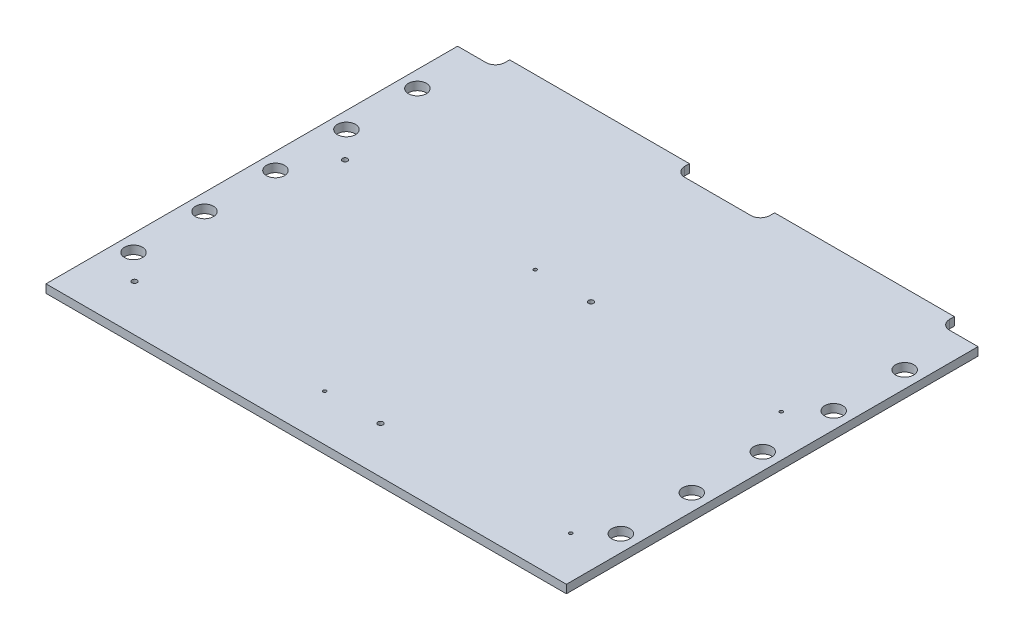
from build123d import *

# Parameters (mm, degrees)
FR4_DEPTH                           = 1.7526
SKETCH7_R                           = 1.905
CUT_EXTRUDE1_DEPTH                  = 143.1375095
SKETCH8_R                           = 0.55
SKETCH8_R_2                         = 0.35
CONTROLLED_DEPTH_HOLES_TOP_DEPTH    = 1.1176
SKETCH9_R                           = 0.55
SKETCH9_R_2                         = 0.35
CONTROLLED_DEPTH_HOLES_BOTTOM_DEPTH = 1.1176


with BuildPart() as part:
    # Sketch1 → FR4 (new body)
    with BuildSketch(Plane(origin=(0, 0, 0), x_dir=(1, 0, 0), z_dir=(0, 1, 0))):
        with BuildLine():
            Line((0, 0), (110, 0))
            Line((110, 0), (110, 87))
            Line((110, 87), (104, 87))
            ThreePointArc((104, 87), (102.585786438, 87.585786438), (102, 89))
            Line((102, 89), (102, 90))
            Line((102, 90), (64, 90))
            Line((64, 90), (64, 89))
            ThreePointArc((64, 89), (63.414213562, 87.585786438), (62, 87))
            Line((62, 87), (48, 87))
            ThreePointArc((48, 87), (46.585786438, 87.585786438), (46, 89))
            Line((46, 89), (46, 90))
            Line((46, 90), (8, 90))
            Line((8, 90), (8, 89))
            ThreePointArc((8, 89), (7.414213562, 87.585786438), (6, 87))
            Line((6, 87), (0, 87))
            Line((0, 87), (0, 0))
        make_face()
    extrude(amount=FR4_DEPTH)

    # Sketch7 → Cut-Extrude1 (cut, through all)
    with BuildSketch(Plane(origin=(0, 1.7526, 0), x_dir=(1, 0, 0), z_dir=(0, 1, 0))):
        with Locations((3.5, 15)):
            Circle(SKETCH7_R)
        with Locations((106.5, 15)):
            Circle(SKETCH7_R)
        with Locations((106.5, 30)):
            Circle(SKETCH7_R)
        with Locations((106.5, 45)):
            Circle(SKETCH7_R)
        with Locations((106.5, 60)):
            Circle(SKETCH7_R)
        with Locations((106.5, 75)):
            Circle(SKETCH7_R)
        with Locations((3.5, 30)):
            Circle(SKETCH7_R)
        with Locations((3.5, 45)):
            Circle(SKETCH7_R)
        with Locations((3.5, 60)):
            Circle(SKETCH7_R)
        with Locations((3.5, 75)):
            Circle(SKETCH7_R)
    extrude(amount=-CUT_EXTRUDE1_DEPTH, mode=Mode.SUBTRACT)

    # Sketch8 → controlled-depth-holes.top (cut)
    with BuildSketch(Plane(origin=(0, 1.7526, 0), x_dir=(1, 0, 0), z_dir=(0, 1, 0))):
        with Locations((8.9, 9.8)):
            Circle(SKETCH8_R)
        with Locations((60.9, 9.8)):
            Circle(SKETCH8_R)
        with Locations((60.9, 54.3)):
            Circle(SKETCH8_R)
        with Locations((8.9, 54.3)):
            Circle(SKETCH8_R)
        with Locations((49.1, 9.8)):
            Circle(SKETCH8_R_2)
        with Locations((101.1, 9.8)):
            Circle(SKETCH8_R_2)
        with Locations((101.1, 54.3)):
            Circle(SKETCH8_R_2)
        with Locations((49.1, 54.3)):
            Circle(SKETCH8_R_2)
    extrude(amount=-CONTROLLED_DEPTH_HOLES_TOP_DEPTH, mode=Mode.SUBTRACT)

    # Sketch9 → controlled-depth-holes.bottom (cut)
    with BuildSketch(Plane.XZ):
        with Locations((8.9, -9.5)):
            Circle(SKETCH9_R)
        with Locations((60.9, -9.5)):
            Circle(SKETCH9_R)
        with Locations((60.9, -54)):
            Circle(SKETCH9_R)
        with Locations((8.9, -54)):
            Circle(SKETCH9_R)
        with Locations((49.1, -9.5)):
            Circle(SKETCH9_R_2)
        with Locations((101.1, -9.5)):
            Circle(SKETCH9_R_2)
        with Locations((101.1, -54)):
            Circle(SKETCH9_R_2)
        with Locations((49.1, -54)):
            Circle(SKETCH9_R_2)
    extrude(amount=-CONTROLLED_DEPTH_HOLES_BOTTOM_DEPTH, mode=Mode.SUBTRACT)


solid = part.part
